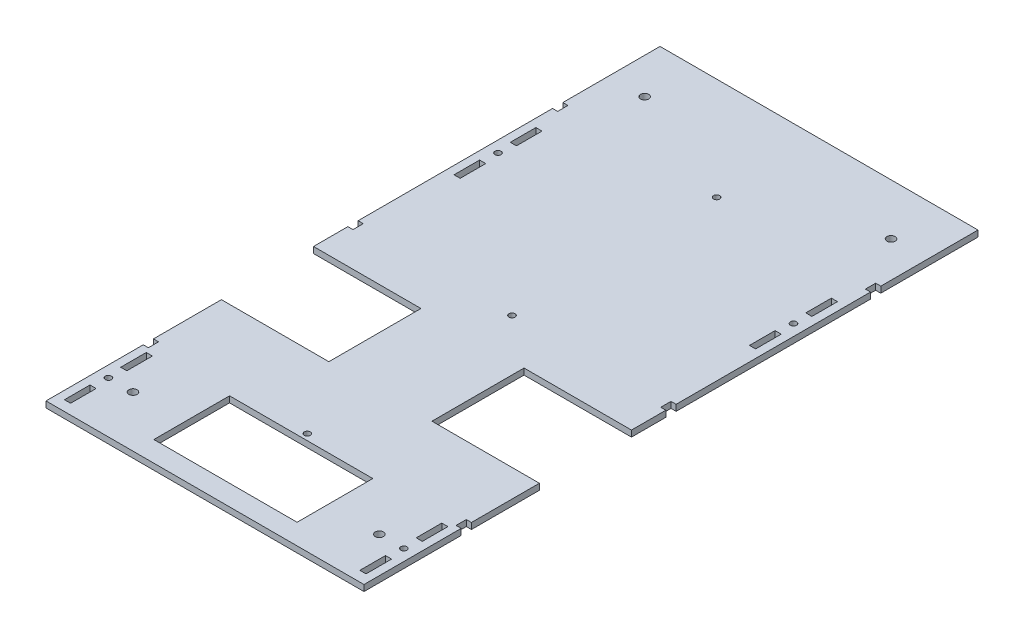
from build123d import *

# Parameters (mm, degrees)
SCHIZZO1_W                   = 160.36
SCHIZZO1_H                   = 300
ESTRUSIONE_ESTRUSIONE1_DEPTH = 3
SCHIZZO3_R                   = 1.5
SCHIZZO3_W                   = 5
SCHIZZO3_H                   = 5
SCHIZZO3_W_2                 = 55
SCHIZZO3_H_2                 = 45
TAGLIO_ESTRUSIONE1_DEPTH     = 171.111235373
SCHIZZO4_R                   = 2
TAGLIO_ESTRUSIONE2_DEPTH     = 171.111235373
SCHIZZO5_R                   = 1.5
SCHIZZO5_W                   = 3
SCHIZZO5_H                   = 12.5
TAGLIO_ESTRUSIONE3_DEPTH     = 171.111235373
SCHIZZO6_W                   = 70
SCHIZZO6_H                   = 37
TAGLIO_ESTRUSIONE4_DEPTH     = 171.111235373
SCHIZZO7_W                   = 2.5
SCHIZZO7_H                   = 47.5
SCHIZZO7_H_2                 = 95
SCHIZZO7_H_3                 = 16.8
SCHIZZO7_H_4                 = 33.2
TAGLIO_ESTRUSIONE5_DEPTH     = 171.111235373


with BuildPart() as part:
    # Schizzo1 → Estrusione-Estrusione1 (new body)
    with BuildSketch(Plane(origin=(0, 0, 0), x_dir=(1, 0, 0), z_dir=(0, 1, 0))):
        Rectangle(SCHIZZO1_W, SCHIZZO1_H)
    extrude(amount=ESTRUSIONE_ESTRUSIONE1_DEPTH)

    # Schizzo3 → Taglio-Estrusione1 (cut, through all)
    with BuildSketch(Plane(origin=(0, 0, 0), x_dir=(1, 0, 0), z_dir=(0, 1, 0))):
        Circle(SCHIZZO3_R)
        with Locations((0, -100)):
            Circle(SCHIZZO3_R)
        with Locations((0, 100)):
            Circle(SCHIZZO3_R)
        with Locations((-5.042705223, -204.043249359)):
            Circle(SCHIZZO3_R)
        with Locations((-77.68, -100)):
            Rectangle(SCHIZZO3_W, SCHIZZO3_H)
        with Locations((-77.68, 0)):
            Rectangle(SCHIZZO3_W, SCHIZZO3_H)
        with Locations((-77.68, 100)):
            Rectangle(SCHIZZO3_W, SCHIZZO3_H)
        with Locations((77.68, -100)):
            Rectangle(SCHIZZO3_W, SCHIZZO3_H)
        with Locations((77.68, 0)):
            Rectangle(SCHIZZO3_W, SCHIZZO3_H)
        with Locations((77.68, 100)):
            Rectangle(SCHIZZO3_W, SCHIZZO3_H)
        with Locations((-52.68, -41.8)):
            Rectangle(SCHIZZO3_W_2, SCHIZZO3_H_2)
        with Locations((52.68, -41.8)):
            Rectangle(SCHIZZO3_W_2, SCHIZZO3_H_2)
    extrude(amount=TAGLIO_ESTRUSIONE1_DEPTH, mode=Mode.SUBTRACT)

    # Schizzo4 → Taglio-Estrusione2 (cut, through all)
    with BuildSketch(Plane(origin=(0, 0, 0), x_dir=(1, 0, 0), z_dir=(0, 1, 0))):
        with Locations((-60.18, -125)):
            Circle(SCHIZZO4_R)
        with Locations((60.18, -125)):
            Circle(SCHIZZO4_R)
        with Locations((-60.18, 125)):
            Circle(SCHIZZO4_R)
        with Locations((60.18, 125)):
            Circle(SCHIZZO4_R)
    extrude(amount=TAGLIO_ESTRUSIONE2_DEPTH, mode=Mode.SUBTRACT)

    # Schizzo5 → Taglio-Estrusione3 (cut, through all)
    with BuildSketch(Plane(origin=(0, 0, 0), x_dir=(1, 0, 0), z_dir=(0, 1, 0))):
        with Locations((72.18, 65.35)):
            Circle(SCHIZZO5_R)
        with Locations((-72.18, 65.35)):
            Circle(SCHIZZO5_R)
        with Locations((72.18, -125)):
            Circle(SCHIZZO5_R)
        with Locations((-72.18, -125)):
            Circle(SCHIZZO5_R)
        with Locations((72.18, 79.1)):
            Rectangle(SCHIZZO5_W, SCHIZZO5_H)
        with Locations((72.18, 51.6)):
            Rectangle(SCHIZZO5_W, SCHIZZO5_H)
        with Locations((-72.18, 51.6)):
            Rectangle(SCHIZZO5_W, SCHIZZO5_H)
        with Locations((-72.18, 79.1)):
            Rectangle(SCHIZZO5_W, SCHIZZO5_H)
        with Locations((72.18, -111.25)):
            Rectangle(SCHIZZO5_W, SCHIZZO5_H)
        with Locations((72.18, -138.75)):
            Rectangle(SCHIZZO5_W, SCHIZZO5_H)
        with Locations((-72.18, -111.25)):
            Rectangle(SCHIZZO5_W, SCHIZZO5_H)
        with Locations((-72.18, -138.75)):
            Rectangle(SCHIZZO5_W, SCHIZZO5_H)
    extrude(amount=TAGLIO_ESTRUSIONE3_DEPTH, mode=Mode.SUBTRACT)

    # Schizzo6 → Taglio-Estrusione4 (cut, through all)
    with BuildSketch(Plane(origin=(0, 0, 0), x_dir=(1, 0, 0), z_dir=(0, 1, 0))):
        with Locations((0, -121.5)):
            Rectangle(SCHIZZO6_W, SCHIZZO6_H)
    extrude(amount=TAGLIO_ESTRUSIONE4_DEPTH, mode=Mode.SUBTRACT)

    # Schizzo7 → Taglio-Estrusione5 (cut, through all)
    with BuildSketch(Plane(origin=(0, 3, 0), x_dir=(1, 0, 0), z_dir=(0, 1, 0))):
        with Locations((-78.93, 126.25)):
            Rectangle(SCHIZZO7_W, SCHIZZO7_H)
        with Locations((-78.93, 50)):
            Rectangle(SCHIZZO7_W, SCHIZZO7_H_2)
        with Locations((-78.93, -10.9)):
            Rectangle(SCHIZZO7_W, SCHIZZO7_H_3)
        with Locations((-78.93, -80.9)):
            Rectangle(SCHIZZO7_W, SCHIZZO7_H_4)
        with Locations((-78.93, -126.25)):
            Rectangle(SCHIZZO7_W, SCHIZZO7_H)
        with Locations((78.93, -126.25)):
            Rectangle(SCHIZZO7_W, SCHIZZO7_H)
        with Locations((78.93, -80.9)):
            Rectangle(SCHIZZO7_W, SCHIZZO7_H_4)
        with Locations((78.93, -10.9)):
            Rectangle(SCHIZZO7_W, SCHIZZO7_H_3)
        with Locations((78.93, 126.25)):
            Rectangle(SCHIZZO7_W, SCHIZZO7_H)
        with Locations((78.93, 50)):
            Rectangle(SCHIZZO7_W, SCHIZZO7_H_2)
    extrude(amount=-TAGLIO_ESTRUSIONE5_DEPTH, mode=Mode.SUBTRACT)


solid = part.part
